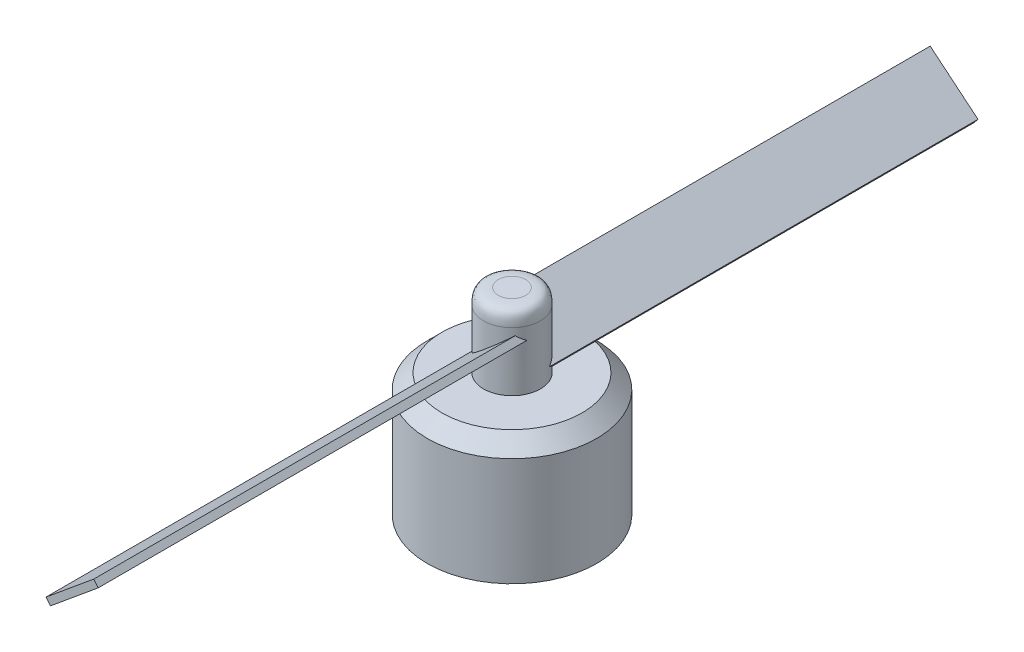
from build123d import *

# Parameters (mm, degrees)
SKETCH1_R           = 11.5
BOSS_EXTRUDE1_DEPTH = 16.7
SKETCH2_R           = 2.5
BOSS_EXTRUDE2_DEPTH = 10
CHAMFER1_SIZE       = 2
SKETCH3_R           = 3.858432037
SKETCH3_R_2         = 2.5
BOSS_EXTRUDE3_DEPTH = 10
BOSS_EXTRUDE4_DEPTH = 59.69
CIRPATTERN1_COUNT   = 2
FILLET2_SIZE        = 2


with BuildPart() as part:
    # Sketch1 → Boss-Extrude1 (new body)
    with BuildSketch(Plane(origin=(0, 0, 0), x_dir=(1, 0, 0), z_dir=(0, 1, 0))):
        with Locations(Location((0, 0, 0), (0, 0, 270))):
            Circle(SKETCH1_R)
    extrude(amount=BOSS_EXTRUDE1_DEPTH)

    # Sketch2 → Boss-Extrude2 (add)
    with BuildSketch(Plane(origin=(0, 16.7, 0), x_dir=(1, 0, 0), z_dir=(0, 1, 0))):
        with Locations(Location((0, 0, 0), (0, 0, 270))):
            Circle(SKETCH2_R)
    extrude(amount=BOSS_EXTRUDE2_DEPTH)

    # Chamfer1
    chamfer1_edges = [part.edges().sort_by_distance(p)[0] for p in [
        (0, 16.7, -11.5),
    ]]
    chamfer(chamfer1_edges, length=CHAMFER1_SIZE)

    # Sketch3 → Boss-Extrude3 (add)
    with BuildSketch(Plane(origin=(0, 16.7, 0), x_dir=(1, 0, 0), z_dir=(0, 1, 0))):
        with Locations(Location((0, 0, 0), (0, 0, 270))):
            Circle(SKETCH3_R)
        Circle(SKETCH3_R_2, mode=Mode.SUBTRACT)
    extrude(amount=BOSS_EXTRUDE3_DEPTH)

    # Sketch4 → Boss-Extrude4 (add)
    with BuildSketch(Plane.XY):
        Polygon((-3.545481948, 18.385879185), (2.939679684, 23.746946134), (3.545481948, 23.014120815), (-2.939679684, 17.653053866), align=None)
    boss_extrude4 = extrude(amount=BOSS_EXTRUDE4_DEPTH)

    # CirPattern1: Boss-Extrude4 ×2 about axis
    cirpattern1_axis = Axis((0, 0, 0), (0, 1, 0))
    for i in range(1, CIRPATTERN1_COUNT):
        add(boss_extrude4.rotate(cirpattern1_axis, i * 360 / CIRPATTERN1_COUNT))

    # Fillet2
    # a fillet whose section is not a circle: 2 mm, written as the material it takes off along each edge
    with BuildSketch(Plane(origin=(0, 26.7, 0), x_dir=(0, 0, 1), z_dir=(-1, 0, 0))) as fillet2_piece_1:
        with BuildLine():
            Bezier((3.858432037, -FILLET2_SIZE), (3.858432037, 0), (3.858432037 - FILLET2_SIZE, 0), weights=[1, 1.5, 1])
            Line((3.858432037 - FILLET2_SIZE, 0), (3.858432037, 0))
            Line((3.858432037, 0), (3.858432037, -FILLET2_SIZE))
        make_face()
    revolve(axis=Axis((0, 26.7, 0), (0, 1, 0)), mode=Mode.SUBTRACT)


solid = part.part
